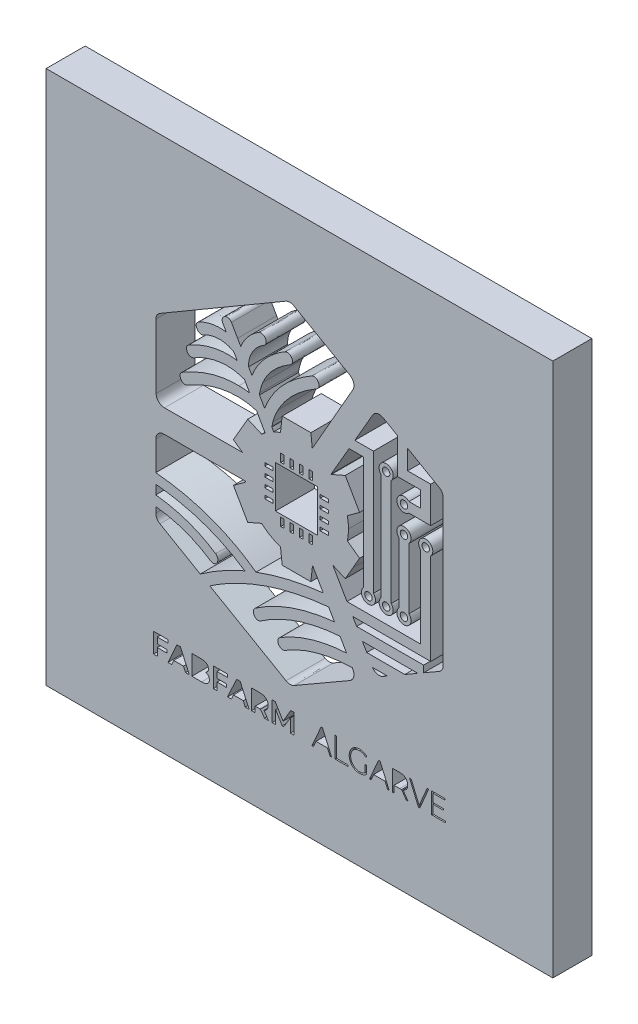
from build123d import *

# Parameters (mm, degrees)
MODEL_W               = 142.75651983
MODEL_H               = 150.537088884
MODEL_W_2             = 0.904914067
MODEL_H_2             = 2.259747545
MODEL_W_3             = 0.904914066
MODEL_W_4             = 0.904913427
MODEL_R               = 1.045302481
MODEL_W_5             = 2.259748185
MODEL_H_3             = 0.904914066
MODEL_H_4             = 0.904914067
MODEL_W_6             = 11.858601765
MODEL_H_5             = 11.858601766
MODEL_H_6             = 0.904913427
MODEL_W_7             = 2.259747545
BOSS_EXTRUDE1_DEPTH   = 11
BOSS_EXTRUDE1_2_DEPTH = 11
BOSS_EXTRUDE1_3_DEPTH = 11


with BuildPart() as part:
    # Model → Boss-Extrude1 (new body)
    with BuildSketch(Plane.XY):
        with Locations((71.378259915, 75.268544442)):
            Rectangle(MODEL_W, MODEL_H)
        Polygon((34.335987854, 27.484013071), (31.306640053, 27.484013071), (31.306640053, 25.790893787), (33.992628084, 25.790893787), (33.992628084, 24.916425423), (31.306640053, 24.916425423), (31.306640053, 22.785226191), (30.273177674, 22.785226191), (30.273177674, 28.350023761), (34.335987854, 28.350023761), align=None, mode=Mode.SUBTRACT)
        Polygon((39.264808724, 22.786917725), (38.70832903, 24.074094298), (35.925929925, 24.074094298), (35.377907266, 22.786917725), (34.312307649, 22.786917725), (36.815620821, 28.351715296), (37.833860667, 28.351715296), (40.345631511, 22.786917725), align=None, mode=Mode.SUBTRACT)
        with BuildLine():
            add(Edge.make_bspline(
                [(44.998749517, 25.679259541), (45.592440412, 25.488127649), (45.998383123, 25.019602636), (45.998383123, 23.341705884), (45.250772177, 22.785226191), (43.81982412, 22.785226191)],
                knots=[0, 0, 0, 0, 1, 1, 2.317756621, 2.317756621, 2.317756621, 2.317756621], degree=3))
            Line((43.81982412, 22.785226191), (41.054339721, 22.785226191))
            Line((41.054339721, 22.785226191), (41.054339721, 28.350023761))
            Line((41.054339721, 28.350023761), (43.662521639, 28.350023761))
            add(Edge.make_bspline(
                [(43.662521639, 28.350023761), (44.998749517, 28.350023761), (45.714223865, 27.785087035), (45.714223865, 26.332150309), (45.428372432, 25.909293531), (44.998749517, 25.679259541)],
                knots=[0, 0, 0, 0, 1, 1, 1.648752719, 1.648752719, 1.648752719, 1.648752719], degree=3))
        make_face(mode=Mode.SUBTRACT)
        Polygon((51.165695655, 27.484013071), (48.136348494, 27.484013071), (48.136348494, 25.790893787), (50.82402742, 25.790893787), (50.82402742, 24.916425423), (48.136348494, 24.916425423), (48.136348494, 22.785226191), (47.102886115, 22.785226191), (47.102886115, 28.350023761), (51.165695655, 28.350023761), align=None, mode=Mode.SUBTRACT)
        Polygon((56.094517164, 22.786917725), (55.538037471, 24.074094298), (52.755638366, 24.074094298), (52.207615706, 22.786917725), (51.14201609, 22.786917725), (53.645329262, 28.351715296), (54.663569108, 28.351715296), (57.175339313, 22.786917725), align=None, mode=Mode.SUBTRACT)
        with BuildLine():
            Line((61.524000924, 22.783534656), (61.524000924, 22.785226191))
            Line((61.524000924, 22.785226191), (60.387361334, 24.414070999))
            add(Edge.make_bspline(
                [(60.387361334, 24.414070999), (60.316321359, 24.405613966), (60.24358985, 24.405613966), (60.172549876, 24.405613966)],
                knots=[0, 0, 0, 0, 1, 1, 1, 1], degree=3))
            Line((60.172549876, 24.405613966), (58.915819006, 24.405613966))
            Line((58.915819006, 24.405613966), (58.915819006, 22.783534656))
            Line((58.915819006, 22.783534656), (57.882355988, 22.783534656))
            Line((57.882355988, 22.783534656), (57.882355988, 28.348332866))
            Line((57.882355988, 28.348332866), (60.172549876, 28.348332866))
            add(Edge.make_bspline(
                [(60.172549876, 28.348332866), (61.63563517, 28.348332866), (62.542240132, 27.60072128), (62.542240132, 25.527031025), (62.112617855, 24.906276856), (61.358240771, 24.61196839)],
                knots=[0, 0, 0, 0, 1, 1, 1.684066171, 1.684066171, 1.684066171, 1.684066171], degree=3))
            Line((61.358240771, 24.61196839), (62.638651845, 22.783534656))
            Line((62.638651845, 22.783534656), (61.524000924, 22.783534656))
        make_face(mode=Mode.SUBTRACT)
        Polygon((69.783243559, 22.785226191), (68.805597984, 22.785226191), (68.79714095, 26.474230257), (66.968707216, 23.421202891), (66.506947702, 23.421202891), (64.678513968, 26.425178953), (64.678513968, 22.785226191), (63.692411359, 22.785226191), (63.692411359, 28.350023761), (64.543199518, 28.350023761), (66.753895759, 24.661019695), (68.923997728, 28.350023761), (69.774786526, 28.350023761), align=None, mode=Mode.SUBTRACT)
        with BuildLine():
            Line((82.808929979, 53.406837599), (84.65089535, 50.220187318))
            add(Edge.make_bspline(
                [(65.948776475, 44.68583545), (71.621825861, 48.138040028), (78.069548828, 49.893742254), (84.65089535, 50.220187318)],
                knots=[0, 0, 0, 0, 1, 1, 1, 1], degree=3))
            add(Edge.make_bspline(
                [(67.372958393, 42.250179184), (65.816845093, 41.302979312), (64.399428035, 43.743710182), (65.948776475, 44.68583545)],
                knots=[0, 0, 0, 0, 1, 1, 1, 1], degree=3))
            add(Edge.make_bspline(
                [(86.252677524, 47.451319849), (79.601982562, 47.344760207), (73.098442153, 45.734520361), (67.372958393, 42.250179184)],
                knots=[0, 0, 0, 0, 1, 1, 1, 1], degree=3))
            Line((86.252677524, 47.451319849), (86.413363074, 47.165468417))
            add(Edge.make_bspline(
                [(85.562574916, 43.987275808), (86.675534302, 44.630018008), (87.056105913, 46.052509031), (86.413363074, 47.165468417)],
                knots=[0, 0, 0, 0, 1, 1, 1, 1], degree=3))
            Line((85.562574916, 43.987275808), (69.913483406, 34.953358953))
            add(Edge.make_bspline(
                [(67.587769851, 34.953358953), (68.306626628, 34.537267675), (69.194626628, 34.537267675), (69.913483406, 34.953358953)],
                knots=[0, 0, 0, 0, 1, 1, 1, 1], degree=3))
            Line((67.587769851, 34.953358953), (46.108326473, 47.354908775))
            add(Edge.make_bspline(
                [(79.607057166, 58.946264709), (67.650352792, 57.870516525), (56.042082791, 54.112163379), (46.108326473, 47.354908775)],
                knots=[0, 0, 0, 0, 1, 1, 1, 1], degree=3))
            Line((79.607057166, 58.946264709), (81.249433611, 56.104665732))
            add(Edge.make_bspline(
                [(59.039292715, 48.415433788), (65.65108494, 52.926472484), (73.33862471, 55.375659748), (81.249433611, 56.104665732)],
                knots=[0, 0, 0, 0, 1, 1, 1, 1], degree=3))
            add(Edge.make_bspline(
                [(60.463475272, 45.979777522), (58.958104812, 44.953080642), (57.549144786, 47.398885476), (59.039292715, 48.415433788)],
                knots=[0, 0, 0, 0, 1, 1, 1, 1], degree=3))
            add(Edge.make_bspline(
                [(82.808929979, 53.406837599), (74.833847242, 52.882495144), (67.109095631, 50.514495783), (60.463475272, 45.979777522)],
                knots=[0, 0, 0, 0, 1, 1, 1, 1], degree=3))
        make_face(mode=Mode.SUBTRACT)
        with BuildLine():
            Line((30.887166345, 61.946857702), (30.887166345, 64.543199518))
            add(Edge.make_bspline(
                [(55.991339952, 55.962585783), (48.525376499, 60.975978264), (39.850042586, 63.758377369), (30.887166345, 64.543199518)],
                knots=[0, 0, 0, 0, 1, 1, 1, 1], degree=3))
            add(Edge.make_bspline(
                [(43.422338443, 48.909331179), (47.361674274, 51.734015451), (51.580096039, 54.074952177), (55.991339952, 55.962585783)],
                knots=[0, 0, 0, 0, 1, 1, 1, 1], degree=3))
            Line((43.422338443, 48.909331179), (32.049177035, 55.47545453))
            add(Edge.make_bspline(
                [(30.88547481, 57.489944914), (30.88547481, 56.659453891), (31.328628723, 55.891545809), (32.049177035, 55.47545453)],
                knots=[0, 0, 0, 0, 1, 1, 1, 1], degree=3))
            Line((30.88547481, 57.489944914), (30.88547481, 59.115407293))
            add(Edge.make_bspline(
                [(46.311297829, 53.584437855), (41.670019286, 56.718653763), (36.391072509, 58.496344658), (30.88547481, 59.115407293)],
                knots=[0, 0, 0, 0, 1, 1, 1, 1], degree=3))
            add(Edge.make_bspline(
                [(47.735479747, 56.020094121), (49.234085348, 55.008620412), (47.820051358, 52.564507113), (46.311297829, 53.584437855)],
                knots=[0, 0, 0, 0, 1, 1, 1, 1], degree=3))
            add(Edge.make_bspline(
                [(30.887166345, 61.946857702), (36.886660795, 61.314263431), (42.695024632, 59.426629825), (47.735479747, 56.020094121)],
                knots=[0, 0, 0, 0, 1, 1, 1, 1], degree=3))
        make_face(mode=Mode.SUBTRACT)
        with BuildLine():
            Line((75.052041769, 66.83846737), (78.067857294, 61.61702893))
            add(Edge.make_bspline(
                [(59.113715758, 57.207476551), (65.189325426, 59.472298699), (71.579540055, 60.920160822), (78.067857294, 61.61702893)],
                knots=[0, 0, 0, 0, 1, 1, 1, 1], degree=3))
            add(Edge.make_bspline(
                [(30.88885724, 67.366192894), (41.018819414, 66.488342101), (50.881535758, 63.272937011), (59.113715758, 57.207476551)],
                knots=[0, 0, 0, 0, 1, 1, 1, 1], degree=3))
            Line((30.88885724, 67.366192894), (30.88885724, 75.605138393))
            add(Edge.make_bspline(
                [(33.214570795, 77.930851948), (31.929085756, 77.930851948), (30.88885724, 76.888932537), (30.88885724, 75.605138393)],
                knots=[0, 0, 0, 0, 1, 1, 1, 1], degree=3))
            Line((33.214570795, 77.930851948), (56.185854274, 77.930851948))
            add(Edge.make_bspline(
                [(56.223065477, 77.729572127), (56.20953384, 77.795537498), (56.197694377, 77.864885938), (56.185854274, 77.930851948)],
                knots=[0, 0, 0, 0, 1, 1, 1, 1], degree=3))
            Line((56.223065477, 77.729572127), (52.765786934, 75.204270286))
            Line((52.765786934, 75.204270286), (56.806607804, 68.194992383))
            Line((56.806607804, 68.194992383), (60.720572536, 69.91517494))
            add(Edge.make_bspline(
                [(66.024890413, 66.853689902), (64.037462664, 67.496432741), (62.234400669, 68.54850072), (60.720572536, 69.91517494)],
                knots=[0, 0, 0, 0, 1, 1, 1, 1], degree=3))
            Line((66.024890413, 66.853689902), (66.498490669, 62.608206142))
            Line((66.498490669, 62.608206142), (74.580133048, 62.608206142))
            Line((74.580133048, 62.608206142), (75.052041769, 66.83846737))
        make_face(mode=Mode.SUBTRACT)
        with Locations((66.553460107, 72.974968125)):
            Rectangle(MODEL_W_2, MODEL_H_2, mode=Mode.SUBTRACT)
        with Locations((69.210696525, 72.974968125)):
            Rectangle(MODEL_W_2, MODEL_H_2, mode=Mode.SUBTRACT)
        Polygon((79.985937243, 22.748014349), (79.26877136, 24.392082968), (76.041526808, 24.392082968), (75.334510132, 22.748014349), (74.898121718, 22.748014349), (77.457252332, 28.590206958), (77.863195043, 28.590206958), (80.422325018, 22.748014349), align=None, mode=Mode.SUBTRACT)
        Polygon((81.408427626, 22.748014349), (81.408427626, 28.590206958), (81.814370337, 28.590206958), (81.814370337, 23.131969029), (85.017935325, 23.131969029), (85.017935325, 22.748014349), align=None, mode=Mode.SUBTRACT)
        with BuildLine():
            Line((89.89770489, 23.63263128), (89.89770489, 25.643739234))
            Line((89.89770489, 25.643739234), (90.286732895, 25.643739234))
            Line((90.286732895, 25.643739234), (90.286732895, 23.456723198))
            add(Edge.make_bspline(
                [(90.286732895, 23.456723198), (89.786070645, 22.956060308), (89.062139264, 22.705729183), (86.621409033, 22.705729183), (85.390049263, 23.965842482), (85.390049263, 27.372378825), (86.621409033, 28.632492764), (89.111190568, 28.632492764), (89.818207883, 28.365246933), (90.3104131, 27.83075591)],
                knots=[0, 0, 0, 0, 1, 1, 3.199555675, 3.199555675, 5.399110525, 5.399110525, 6.447043345, 6.447043345, 6.447043345, 6.447043345], degree=3))
            Line((90.3104131, 27.83075591), (90.056698906, 27.546596012))
            add(Edge.make_bspline(
                [(90.056698906, 27.546596012), (89.571259187, 28.047258263), (88.991099289, 28.24008105), (86.870048624, 28.24008105), (85.795991974, 27.138961766), (85.795991974, 24.207717214), (86.86835709, 23.098140257), (88.904836783, 23.098140257), (89.44440177, 23.248677239), (89.89770489, 23.63263128)],
                knots=[0, 0, 0, 0, 1, 1, 3.142858631, 3.142858631, 5.273387966, 5.273387966, 6.139537487, 6.139537487, 6.139537487, 6.139537487], degree=3))
        make_face(mode=Mode.SUBTRACT)
        Polygon((96.203347909, 22.748014349), (95.486182666, 24.392082968), (92.258938113, 24.392082968), (91.551921438, 22.748014349), (91.115533023, 22.748014349), (93.674663637, 28.590206958), (94.080606348, 28.590206958), (96.639736323, 22.748014349), align=None, mode=Mode.SUBTRACT)
        with BuildLine():
            Line((101.489060824, 22.746323454), (101.489060824, 22.748014349))
            Line((101.489060824, 22.748014349), (100.16128998, 24.701613966))
            add(Edge.make_bspline(
                [(100.16128998, 24.701613966), (99.987072794, 24.676242227), (99.811164072, 24.65932816), (99.620032819, 24.65932816)],
                knots=[0, 0, 0, 0, 1, 1, 1, 1], degree=3))
            Line((99.620032819, 24.65932816), (98.030090108, 24.65932816))
            Line((98.030090108, 24.65932816), (98.030090108, 22.748014349))
            Line((98.030090108, 22.748014349), (97.624148036, 22.748014349))
            Line((97.624148036, 22.748014349), (97.624148036, 28.590206958))
            Line((97.624148036, 28.590206958), (99.620032819, 28.590206958))
            add(Edge.make_bspline(
                [(99.620032819, 28.590206958), (101.018843638, 28.590206958), (101.861174763, 27.856127009), (101.861174763, 25.692790539), (101.384192078, 25.050048339), (100.557083484, 24.791259541)],
                knots=[0, 0, 0, 0, 1, 1, 1.74965824, 1.74965824, 1.74965824, 1.74965824], degree=3))
            Line((100.557083484, 24.791259541), (101.94743727, 22.746323454))
            Line((101.94743727, 22.746323454), (101.489060824, 22.746323454))
        make_face(mode=Mode.SUBTRACT)
        Polygon((107.348166861, 28.590206958), (107.769332743, 28.590206958), (105.289699137, 22.748014349), (104.883756426, 22.748014349), (102.404123459, 28.590206958), (102.848968906, 28.590206958), (105.098567884, 23.297728544), align=None, mode=Mode.SUBTRACT)
        Polygon((109.049743817, 23.131969029), (112.483342155, 23.131969029), (112.483342155, 22.748014349), (108.643801106, 22.748014349), (108.643801106, 28.590206958), (112.364942411, 28.590206958), (112.364942411, 28.206252917), (109.049743817, 28.206252917), (109.049743817, 25.902528032), (112.014816503, 25.902528032), (112.014816503, 25.527031025), (109.049743817, 25.527031025), align=None, mode=Mode.SUBTRACT)
        with BuildLine():
            Line((96.165501524, 50.387998767), (94.911097371, 49.663707616))
            add(Edge.make_bspline(
                [(91.964140913, 50.387998767), (92.58837073, 49.402656208), (93.890394496, 49.075031212), (94.911097371, 49.663707616)],
                knots=[0.025111073, 0.025111073, 0.025111073, 0.025111073, 1, 1, 1, 1], degree=3))
            Line((91.964140913, 50.387998767), (96.165501524, 50.387998767))
        make_face(mode=Mode.SUBTRACT)
        Polygon((89.109198608, 55.32585962), (104.466556554, 55.32585962), (104.466556554, 55.182167297), (101.048502359, 53.207998775), (90.332702835, 53.207998775), align=None, mode=Mode.SUBTRACT)
        with Locations((71.86792847, 72.974968125)):
            Rectangle(MODEL_W_3, MODEL_H_2, mode=Mode.SUBTRACT)
        with Locations((74.525160095, 72.974968125)):
            Rectangle(MODEL_W_4, MODEL_H_2, mode=Mode.SUBTRACT)
        with Locations((90.804309852, 67.190284173)):
            Circle(MODEL_R, mode=Mode.SUBTRACT)
        with Locations((62.723221538, 76.805208291)):
            Rectangle(MODEL_W_5, MODEL_H_3, mode=Mode.SUBTRACT)
        with Locations((62.723221538, 79.462440235)):
            Rectangle(MODEL_W_5, MODEL_H_3, mode=Mode.SUBTRACT)
        with Locations((62.723221538, 82.11967154)):
            Rectangle(MODEL_W_5, MODEL_H_4, mode=Mode.SUBTRACT)
        with Locations((70.53846769, 80.791900376)):
            Rectangle(MODEL_W_6, MODEL_H_5, mode=Mode.SUBTRACT)
        with Locations((62.723221538, 84.776908279)):
            Rectangle(MODEL_W_5, MODEL_H_6, mode=Mode.SUBTRACT)
        with Locations((66.553460107, 88.608835185)):
            Rectangle(MODEL_W_2, MODEL_H_2, mode=Mode.SUBTRACT)
        with Locations((69.210696525, 88.608835185)):
            Rectangle(MODEL_W_2, MODEL_H_2, mode=Mode.SUBTRACT)
        with BuildLine():
            Line((55.29616274, 84.529112538), (33.329588109, 84.412403689))
            add(Edge.make_bspline(
                [(30.990342917, 86.727968676), (30.997109055, 85.442483637), (32.044102431, 84.40563819), (33.329588109, 84.412403689)],
                knots=[0, 0, 0, 0, 1, 1, 1, 1], degree=3))
            Line((30.990342917, 86.727968676), (30.900697342, 104.79749392))
            add(Edge.make_bspline(
                [(32.054251638, 106.817058907), (31.337085756, 106.397584559), (30.897314273, 105.627984943), (30.900697342, 104.79749392)],
                knots=[0, 0, 0, 0, 1, 1, 1, 1], degree=3))
            Line((32.054251638, 106.817058907), (67.493050311, 127.515062566))
            add(Edge.make_bspline(
                [(69.818763226, 127.526902668), (69.096524019, 127.939610878), (68.210215554, 127.934536914), (67.493050311, 127.515062566)],
                knots=[0, 0, 0, 0, 1, 1, 1, 1], degree=3))
            Line((69.818763226, 127.526902668), (85.550734813, 118.547111721))
            add(Edge.make_bspline(
                [(86.418437678, 115.373992437), (87.054414379, 116.490334892), (86.667077269, 117.911134381), (85.550734813, 118.547111721)],
                knots=[0, 0, 0, 0, 1, 1, 1, 1], degree=3))
            Line((86.418437678, 115.373992437), (74.984384224, 95.340719648))
            Line((74.984384224, 95.340719648), (74.578441513, 98.97728998))
            Line((74.578441513, 98.97728998), (66.496799134, 98.97728998))
            Line((66.496799134, 98.97728998), (66.023198879, 94.731805581))
            add(Edge.make_bspline(
                [(64.103428674, 93.952057397), (64.720799774, 94.253132), (65.361851078, 94.516994763), (66.023198879, 94.731805581)],
                knots=[0, 0, 0, 0, 1, 1, 1, 1], degree=3))
            add(Edge.make_bspline(
                [(63.584160183, 94.858662998), (63.756685835, 94.555897499), (63.929211487, 94.254822896), (64.103428674, 93.952057397)],
                knots=[0, 0, 0, 0, 1, 1, 1, 1], degree=3))
            add(Edge.make_bspline(
                [(63.621371385, 95.063325888), (63.614605886, 94.990594379), (63.59769118, 94.924628369), (63.584160183, 94.858662998)],
                knots=[0, 0, 0, 0, 1, 1, 1, 1], degree=3))
            add(Edge.make_bspline(
                [(63.624754454, 95.10053709), (63.624754454, 95.090388522), (63.623062919, 95.07854842), (63.621371385, 95.063325888)],
                knots=[0, 0, 0, 0, 1, 1, 1, 1], degree=3))
            add(Edge.make_bspline(
                [(63.634903022, 95.146205965), (63.631519953, 95.127599724), (63.628136884, 95.114068727), (63.624754454, 95.10053709)],
                knots=[0, 0, 0, 0, 1, 1, 1, 1], degree=3))
            add(Edge.make_bspline(
                [(63.883542613, 96.276079418), (63.783748469, 95.902273944), (63.712708495, 95.525085402), (63.634903022, 95.146205965)],
                knots=[0, 0, 0, 0, 1, 1, 1, 1], degree=3))
            add(Edge.make_bspline(
                [(65.366925042, 99.975232691), (64.734330771, 98.799690364), (64.225211487, 97.568330594), (63.883542613, 96.276079418)],
                knots=[0, 0, 0, 0, 1, 1, 1, 1], degree=3))
            add(Edge.make_bspline(
                [(76.203903892, 110.479000339), (71.796043048, 107.919869725), (67.807655912, 104.515024917), (65.366925042, 99.975232691)],
                knots=[0, 0, 0, 0, 1, 1, 1, 1], degree=3))
            add(Edge.make_bspline(
                [(74.779721974, 112.914656605), (76.354440874, 113.82971924), (77.773549468, 111.390679904), (76.203903892, 110.479000339)],
                knots=[0, 0, 0, 0, 1, 1, 1, 1], degree=3))
            add(Edge.make_bspline(
                [(62.931268776, 101.39941461), (65.588501999, 106.34684172), (69.979449416, 110.127182897), (74.779721974, 112.914656605)],
                knots=[0, 0, 0, 0, 1, 1, 1, 1], degree=3))
            add(Edge.make_bspline(
                [(61.564595195, 98.38528998), (61.941783738, 99.43397553), (62.420457318, 100.448832308), (62.931268776, 101.39941461)],
                knots=[0, 0, 0, 0, 1, 1, 1, 1], degree=3))
            add(Edge.make_bspline(
                [(60.10489297, 100.934272027), (60.592024224, 100.085175402), (61.077463942, 99.234387244), (61.564595195, 98.38528998)],
                knots=[0, 0, 0, 0, 1, 1, 1, 1], degree=3))
            add(Edge.make_bspline(
                [(60.179315374, 101.500900287), (60.087978264, 101.022226707), (60.128572536, 101.335140773), (60.10489297, 100.934272027)],
                knots=[0, 0, 0, 0, 1, 1, 1, 1], degree=3))
            add(Edge.make_bspline(
                [(61.070697804, 104.509950953), (60.657989594, 103.545837014), (60.373829697, 102.530980236), (60.179315374, 101.500900287)],
                knots=[0, 0, 0, 0, 1, 1, 1, 1], degree=3))
            add(Edge.make_bspline(
                [(68.719335477, 112.630496707), (65.444730515, 110.715799828), (62.586217472, 108.045035607), (61.070697804, 104.509950953)],
                knots=[0, 0, 0, 0, 1, 1, 1, 1], degree=3))
            add(Edge.make_bspline(
                [(67.29515292, 115.066152974), (68.86648939, 115.986289572), (70.285597344, 113.545559342), (68.719335477, 112.630496707)],
                knots=[0, 0, 0, 0, 1, 1, 1, 1], degree=3))
            add(Edge.make_bspline(
                [(58.009213405, 104.65541397), (59.583932945, 109.08357195), (63.431931666, 112.806404789), (67.29515292, 115.066152974)],
                knots=[0, 0, 0, 0, 1, 1, 1, 1], degree=3))
            add(Edge.make_bspline(
                [(57.950013533, 104.696008242), (57.968619134, 104.682476605), (57.992299338, 104.668944968), (58.009213405, 104.65541397)],
                knots=[0, 0, 0, 0, 1, 1, 1, 1], degree=3))
            add(Edge.make_bspline(
                [(57.046791001, 106.274110211), (57.347864965, 105.748076221), (57.648939569, 105.222042231), (57.950013533, 104.696008242)],
                knots=[0, 0, 0, 0, 1, 1, 1, 1], degree=3))
            add(Edge.make_bspline(
                [(61.315954965, 113.648735915), (58.748367318, 112.114611285), (56.926699722, 109.320372078), (57.046791001, 106.274110211)],
                knots=[0, 0, 0, 0, 1, 1, 1, 1], degree=3))
            add(Edge.make_bspline(
                [(59.891773047, 116.084392181), (61.45634338, 117.018060416), (62.872068904, 114.57902172), (61.315954965, 113.648735915)],
                knots=[0, 0, 0, 0, 1, 1, 1, 1], degree=3))
            add(Edge.make_bspline(
                [(54.846243328, 110.115343434), (55.778220029, 112.594976401), (57.647248034, 114.743090339), (59.891773047, 116.084392181)],
                knots=[0, 0, 0, 0, 1, 1, 1, 1], degree=3))
            add(Edge.make_bspline(
                [(53.939637727, 111.698520007), (54.242403226, 111.170794482), (54.543477829, 110.643068958), (54.846243328, 110.115343434)],
                knots=[0, 0, 0, 0, 1, 1, 1, 1], degree=3))
            add(Edge.make_bspline(
                [(52.217764274, 114.705878498), (52.791158034, 113.702861823), (53.366243967, 112.701536682), (53.939637727, 111.698520007)],
                knots=[0, 0, 0, 0, 1, 1, 1, 1], degree=3))
            add(Edge.make_bspline(
                [(49.782108008, 113.28169658), (48.877193942, 114.861490084), (51.316233277, 116.280598038), (52.217764274, 114.705878498)],
                knots=[0, 0, 0, 0, 1, 1, 1, 1], degree=3))
            add(Edge.make_bspline(
                [(50.747913481, 111.595342794), (50.426541742, 112.156896452), (50.103479108, 112.720142283), (49.782108008, 113.28169658)],
                knots=[0, 0, 0, 0, 1, 1, 1, 1], degree=3))
            add(Edge.make_bspline(
                [(42.969035962, 110.155937705), (45.282909414, 111.463411413), (48.104211256, 112.031731209), (50.747913481, 111.595342794)],
                knots=[0, 0, 0, 0, 1, 1, 1, 1], degree=3))
            add(Edge.make_bspline(
                [(44.393218519, 107.720281439), (42.808350412, 106.82551594), (41.389242458, 109.262863741), (42.969035962, 110.155937705)],
                knots=[0, 0, 0, 0, 1, 1, 1, 1], degree=3))
            add(Edge.make_bspline(
                [(52.916323916, 107.80823548), (50.316599031, 109.420166221), (46.999708903, 109.193514661), (44.393218519, 107.720281439)],
                knots=[0, 0, 0, 0, 1, 1, 1, 1], degree=3))
            add(Edge.make_bspline(
                [(53.853375221, 106.170932999), (53.540460515, 106.717264124), (53.229237983, 107.261904354), (52.916323916, 107.80823548)],
                knots=[0, 0, 0, 0, 1, 1, 1, 1], degree=3))
            add(Edge.make_bspline(
                [(40.218774094, 103.205859674), (44.102292483, 105.462224789), (49.220553711, 106.977744457), (53.853375221, 106.170932999)],
                knots=[0, 0, 0, 0, 1, 1, 1, 1], degree=3))
            add(Edge.make_bspline(
                [(41.642956652, 100.770203408), (40.068237112, 99.855141413), (38.649129158, 102.294180108), (40.218774094, 103.205859674)],
                knots=[0, 0, 0, 0, 1, 1, 1, 1], degree=3))
            add(Edge.make_bspline(
                [(52.452872868, 103.439276733), (48.621788213, 103.83676241), (44.931092611, 102.681517218), (41.642956652, 100.770203408)],
                knots=[0, 0, 0, 0, 1, 1, 1, 1], degree=3))
            add(Edge.make_bspline(
                [(55.463614428, 102.757631796), (54.49273499, 103.099300032), (53.476186678, 103.334408625), (52.452872868, 103.439276733)],
                knots=[0, 0, 0, 0, 1, 1, 1, 1], degree=3))
            add(Edge.make_bspline(
                [(55.891545809, 102.610477244), (55.803591129, 102.642614482), (55.695339952, 102.676443254), (55.463614428, 102.757631796)],
                knots=[0, 0, 0, 0, 1, 1, 1, 1], degree=3))
            add(Edge.make_bspline(
                [(57.366470566, 100.034432564), (56.874265349, 100.893677755), (56.383751026, 101.751232052), (55.891545809, 102.610477244)],
                knots=[0, 0, 0, 0, 1, 1, 1, 1], degree=3))
            add(Edge.make_bspline(
                [(54.304986167, 100.294912257), (55.309694377, 100.272923587), (56.34484829, 100.195118113), (57.366470566, 100.034432564)],
                knots=[0, 0, 0, 0, 1, 1, 1, 1], degree=3))
            add(Edge.make_bspline(
                [(38.414020565, 95.631645683), (43.217676192, 98.447872922), (48.674222586, 100.41331264), (54.304986167, 100.294912257)],
                knots=[0, 0, 0, 0, 1, 1, 1, 1], degree=3))
            add(Edge.make_bspline(
                [(39.838203123, 93.195989417), (38.266866013, 92.274161284), (36.849449593, 94.714891515), (38.414020565, 95.631645683)],
                knots=[0, 0, 0, 0, 1, 1, 1, 1], degree=3))
            add(Edge.make_bspline(
                [(54.304986167, 97.473610415), (49.15458834, 97.580170696), (44.230841435, 95.772034098), (39.838203123, 93.195989417)],
                knots=[0, 0, 0, 0, 1, 1, 1, 1], degree=3))
            add(Edge.make_bspline(
                [(58.210493226, 96.966182026), (56.931773686, 97.296010799), (55.624299978, 97.446547781), (54.304986167, 97.473610415)],
                knots=[0, 0, 0, 0, 1, 1, 1, 1], degree=3))
            add(Edge.make_bspline(
                [(59.314995579, 96.63127929), (58.947955605, 96.747988139), (58.584298699, 96.869770952), (58.210493226, 96.966182026)],
                knots=[0, 0, 0, 0, 1, 1, 1, 1], degree=3))
            add(Edge.make_bspline(
                [(59.99156719, 95.450662998), (59.766607165, 95.844765607), (59.541647139, 96.237176681), (59.314995579, 96.63127929)],
                knots=[0, 0, 0, 0, 1, 1, 1, 1], degree=3))
            add(Edge.make_bspline(
                [(61.698217471, 92.470366502), (61.129897676, 93.46323461), (60.559886986, 94.457794251), (59.99156719, 95.450662998)],
                knots=[0, 0, 0, 0, 1, 1, 1, 1], degree=3))
            add(Edge.make_bspline(
                [(60.718881001, 91.666938753), (61.031795067, 91.949407116), (61.359932305, 92.214960773), (61.698217471, 92.470366502)],
                knots=[0, 0, 0, 0, 1, 1, 1, 1], degree=3))
            Line((60.718881001, 91.666938753), (56.804916908, 93.387120671))
            Line((56.804916908, 93.387120671), (52.764095399, 86.377843407))
            Line((52.764095399, 86.377843407), (55.29616274, 84.529112538))
        make_face(mode=Mode.SUBTRACT)
        with Locations((78.355401859, 76.805208291)):
            Rectangle(MODEL_W_7, MODEL_H_3, mode=Mode.SUBTRACT)
        with Locations((78.355401859, 79.462440235)):
            Rectangle(MODEL_W_7, MODEL_H_3, mode=Mode.SUBTRACT)
        with Locations((78.355401859, 82.11967154)):
            Rectangle(MODEL_W_7, MODEL_H_4, mode=Mode.SUBTRACT)
        with Locations((71.86792847, 88.608835185)):
            Rectangle(MODEL_W_3, MODEL_H_2, mode=Mode.SUBTRACT)
        with Locations((74.525160095, 88.608835185)):
            Rectangle(MODEL_W_4, MODEL_H_2, mode=Mode.SUBTRACT)
        with Locations((78.355401859, 84.776908279)):
            Rectangle(MODEL_W_7, MODEL_H_6, mode=Mode.SUBTRACT)
        with BuildLine():
            Line((101.845300976, 108.814326393), (110.775000324, 103.659162782))
            add(Edge.make_bspline(
                [(111.871045644, 101.761380608), (111.86935411, 102.541128792), (111.449879762, 103.268442603), (110.775000324, 103.659162782)],
                knots=[0, 0, 0, 0, 1, 1, 1, 1], degree=3))
            Line((111.871045644, 101.761380608), (111.871045644, 60.722264058))
            add(Edge.make_bspline(
                [(110.775000324, 58.824481884), (111.451571296, 59.215201424), (111.871045644, 59.942515235), (111.871045644, 60.722264058)],
                knots=[0, 0, 0, 0, 1, 1, 1, 1], degree=3))
            Line((110.775000324, 58.824481884), (106.351556554, 56.270668737))
            Line((106.351556554, 56.270668737), (106.351556554, 58.14585962))
            Line((106.351556554, 58.14585962), (87.479876163, 58.14585962))
            Line((87.479876163, 58.14585962), (86.384993273, 60.040423329))
            Line((86.384993273, 60.040423329), (108.357183048, 60.040423329))
            Line((108.357183048, 60.040423329), (108.360273332, 85.781502734))
            ThreePointArc((108.360273332, 85.781502734), (106.94308161, 89.178846533), (105.540272596, 85.77553871))
            Line((105.540272596, 85.77553871), (105.537521576, 62.860423329))
            Line((105.537521576, 62.860423329), (84.757165209, 62.860423329))
            Line((84.757165209, 62.860423329), (80.789364977, 69.727426105))
            Line((80.789364977, 69.727426105), (84.273706793, 68.196683905))
            Line((84.273706793, 68.196683905), (86.465797433, 71.999013752))
            Line((86.465797433, 71.999013752), (88.314528302, 75.205961169))
            Line((88.314528302, 75.205961169), (84.85724976, 77.73126365))
            add(Edge.make_bspline(
                [(84.85724976, 77.73126365), (85.066986614, 78.719057154), (85.188769428, 79.742370965), (85.188769428, 81.843124495), (85.066986614, 82.866438945), (84.85724976, 83.854232449)],
                knots=[0, 0, 0, 0, 1, 1, 1.999999391, 1.999999391, 1.999999391, 1.999999391], degree=3))
            Line((84.85724976, 83.854232449), (88.314528302, 86.37953429))
            Line((88.314528302, 86.37953429), (84.273706793, 93.388812193))
            Line((84.273706793, 93.388812193), (80.359742701, 91.668629636))
            add(Edge.make_bspline(
                [(80.287011192, 91.729521042), (80.310691397, 91.709223907), (80.336062496, 91.688926771), (80.359742701, 91.668629636)],
                knots=[0, 0, 0, 0, 1, 1, 1, 1], degree=3))
            Line((80.287011192, 91.729521042), (85.342320746, 100.477391938))
            Line((85.342320746, 100.477391938), (89.397693226, 100.477391938))
            Line((89.397693226, 100.477391938), (89.397693226, 68.592450499))
            ThreePointArc((89.397693226, 68.592450499), (90.799505768, 65.204178017), (92.217693226, 68.585629355))
            Line((92.217693226, 68.585629355), (92.217693226, 103.297391938))
            Line((92.217693226, 103.297391938), (86.973448224, 103.297391938))
            Line((86.973448224, 103.297391938), (91.988309837, 111.977605289))
            add(Edge.make_bspline(
                [(91.988309837, 111.977605289), (92.394252548, 112.679548), (93.131714927, 113.071959074), (94.261589019, 113.071959074), (94.637086027, 112.97893043), (94.982137331, 112.779342143)],
                knots=[0, 0, 0, 0, 1, 1, 1.491072129, 1.491072129, 1.491072129, 1.491072129], degree=3))
            Line((94.982137331, 112.779342143), (99.025300976, 110.444054964))
            Line((99.025300976, 110.444054964), (99.025300976, 100.477391938))
            Line((99.025300976, 100.477391938), (105.540681168, 100.477391938))
            Line((105.540681168, 100.477391938), (105.540681168, 95.991268907))
            Line((105.540681168, 95.991268907), (102.218909138, 95.991268907))
            ThreePointArc((102.218909138, 95.991268907), (98.825062894, 94.58535781), (102.215509902, 93.171268907))
            Line((102.215509902, 93.171268907), (108.360681168, 93.171268907))
            Line((108.360681168, 93.171268907), (108.360681168, 103.297391938))
            Line((108.360681168, 103.297391938), (101.845300976, 103.297391938))
            Line((101.845300976, 103.297391938), (101.845300976, 108.814326393))
        make_face(mode=Mode.SUBTRACT)
        with Locations((106.947295557, 87.186343842)):
            Circle(MODEL_R, mode=Mode.SUBTRACT)
        with Locations((100.814180733, 94.582960122)):
            Circle(MODEL_R, mode=Mode.SUBTRACT)
    extrude(amount=-BOSS_EXTRUDE1_DEPTH)


with BuildPart() as body_2:
    # Model → Boss-Extrude1 2 (new body)
    with BuildSketch(Plane.XY):
        with BuildLine():
            ThreePointArc((94.389127575, 68.581875892), (95.823588171, 65.199178941), (97.209126424, 68.602206947))
            Line((97.209126424, 68.602206947), (97.207426358, 98.630013065))
            ThreePointArc((97.207426358, 98.630013065), (95.797376785, 102.030318064), (94.38742637, 98.629971947))
            Line((94.38742637, 98.629971947), (94.389127575, 68.581875892))
        make_face()
        with Locations((95.8092453, 67.188592638)):
            Circle(MODEL_R, mode=Mode.SUBTRACT)
        with Locations((95.797405837, 100.037815633)):
            Circle(MODEL_R, mode=Mode.SUBTRACT)
    extrude(amount=-BOSS_EXTRUDE1_2_DEPTH)


with BuildPart() as body_3:
    # Model → Boss-Extrude1 3 (new body)
    with BuildSketch(Plane.XY):
        with BuildLine():
            ThreePointArc((99.402489533, 68.594014379), (100.816576381, 65.199474077), (102.222489533, 68.597407814))
            Line((102.222489533, 68.597407814), (102.222489533, 85.778522757))
            ThreePointArc((102.222489533, 85.778522757), (100.812489533, 89.178848108), (99.402489533, 85.778522757))
            Line((99.402489533, 85.778522757), (99.402489533, 68.594014379))
        make_face()
        with Locations((100.814180748, 67.190284173)):
            Circle(MODEL_R, mode=Mode.SUBTRACT)
        with Locations((100.812489533, 87.18634576)):
            Circle(MODEL_R, mode=Mode.SUBTRACT)
    extrude(amount=-BOSS_EXTRUDE1_3_DEPTH)


solid = Compound([part.part, body_2.part, body_3.part])
